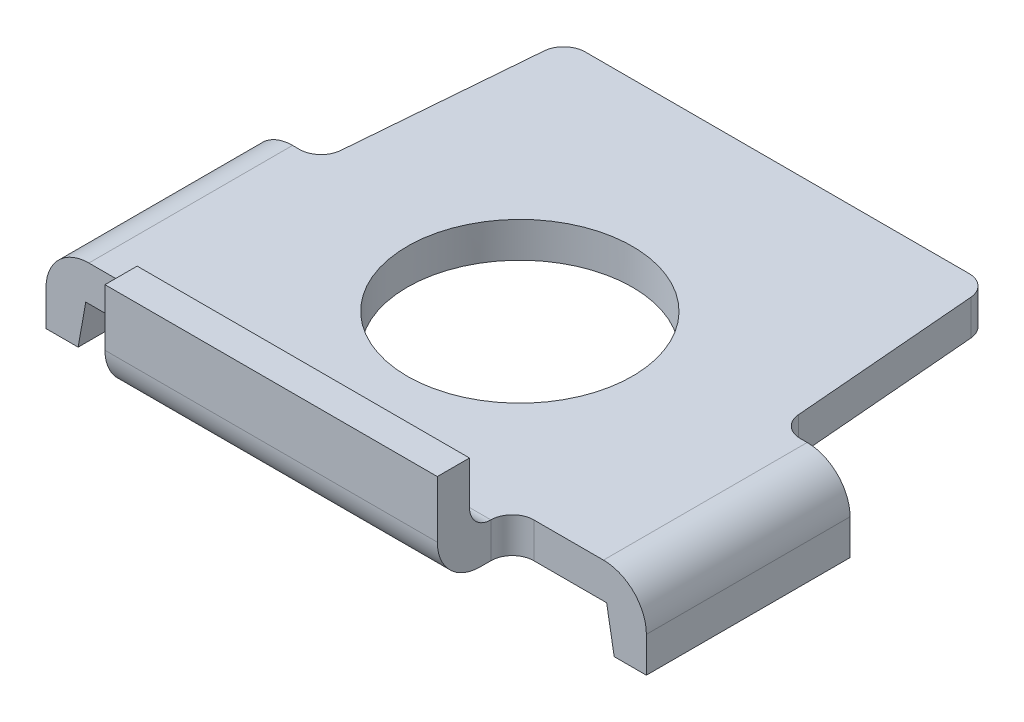
from build123d import *

# Parameters (mm, degrees)
RESSALTO_EXTRUS_O1_DEPTH = 1.65
ESBO_O2_W                = 15.5
ESBO_O2_H                = 1.5
RESSALTO_EXTRUS_O2_DEPTH = 3
ESBO_O3_W                = 1.5
ESBO_O3_H                = 9.5
RESSALTO_EXTRUS_O3_DEPTH = 2
ESBO_O4_R                = 5.25
CORTE_EXTRUS_O1_DEPTH    = 26.913997794
FILETE1_R                = 2
CHANFRO1_SIZE            = 0.352653961
CHANFRO1_SIZE_2          = 2
FILETE3_R                = 2
FILETE4_R                = 1
FILETE5_R                = 1
FILETE6_R                = 1
FILETE7_R                = 1


with BuildPart() as part:
    # Esboço1 → Ressalto-extrusão1 (new body)
    with BuildSketch(Plane(origin=(0, 0, 0), x_dir=(1, 0, 0), z_dir=(0, 1, 0))):
        Polygon((-9.875, 2.10086556), (9.875, 2.10086556), (10.75, -8.49913444), (14, -8.49913444), (14, -17.99913444), (7.75, -17.99913444), (7.75, -21.49913444), (-7.75, -21.49913444), (-7.75, -17.99913444), (-14, -17.99913444), (-14, -8.49913444), (-10.75, -8.49913444), align=None)
    extrude(amount=RESSALTO_EXTRUS_O1_DEPTH)

    # Esboço2 → Ressalto-extrusão2 (add)
    with BuildSketch(Plane(origin=(0, 1.65, 0), x_dir=(1, 0, 0), z_dir=(0, 1, 0))):
        with Locations((0, -20.74913444)):
            Rectangle(ESBO_O2_W, ESBO_O2_H)
    extrude(amount=RESSALTO_EXTRUS_O2_DEPTH)

    # Esboço3 → Ressalto-extrusão3 (add)
    with BuildSketch(Plane.XZ):
        with Locations((-13.25, 13.24913444)):
            Rectangle(ESBO_O3_W, ESBO_O3_H)
        with Locations((13.25, 13.24913444)):
            Rectangle(ESBO_O3_W, ESBO_O3_H)
    extrude(amount=RESSALTO_EXTRUS_O3_DEPTH)

    # Esboço4 → Corte-extrusão1 (cut, through all)
    with BuildSketch(Plane(origin=(0, 1.65, 0), x_dir=(1, 0, 0), z_dir=(0, 1, 0))):
        with Locations(Location((0, -9.89913444, 0), (0, 0, 270))):
            Circle(ESBO_O4_R)
    extrude(amount=-CORTE_EXTRUS_O1_DEPTH, mode=Mode.SUBTRACT)

    # Filete1
    filete1_edges = [part.edges().sort_by_distance(p)[0] for p in [
        (14, 1.65, 13.24913444),
        (-14, 1.65, 13.24913444),
    ]]
    fillet(filete1_edges, radius=FILETE1_R)

    # Chanfro1
    # the kernel refuses this chamfer: 2, 0.352653961 mm, written as the material it adds along each edge
    with BuildSketch(Plane(origin=(12.5, 0, 17.99913444), x_dir=(-0.9776715712462587, 0.21013876076743104, 0), z_dir=(0, 0, -1))) as chanfro1_piece_1_section:
        Polygon((CHANFRO1_SIZE * 0.977671572402, -CHANFRO1_SIZE * 0.210138761016), (-CHANFRO1_SIZE_2 * 0.210138760767, -CHANFRO1_SIZE_2 * 0.977671571246), (0, 0), align=None)
    chanfro1_piece_1 = extrude(amount=9.5, mode=Mode.PRIVATE)
    chanfro1_piece_1 = split(chanfro1_piece_1, bisect_by=Plane(origin=(12.403792596, -2, 13.24913444), z_dir=(0, 1, 0)), keep=Keep.TOP, mode=Mode.PRIVATE)
    add(chanfro1_piece_1)
    with BuildSketch(Plane(origin=(-12.5, 0, 17.99913444), x_dir=(0.9776715712462587, 0.21013876076743104, 0), z_dir=(0, 0, -1))) as chanfro1_piece_2_section:
        Polygon((CHANFRO1_SIZE * 0.977671572402, CHANFRO1_SIZE * 0.210138761016), (-CHANFRO1_SIZE_2 * 0.210138760767, CHANFRO1_SIZE_2 * 0.977671571246), (0, 0), align=None)
    chanfro1_piece_2 = extrude(amount=9.5, mode=Mode.PRIVATE)
    chanfro1_piece_2 = split(chanfro1_piece_2, bisect_by=Plane(origin=(-12.403792596, -2, 13.24913444), z_dir=(0, 1, 0)), keep=Keep.TOP, mode=Mode.PRIVATE)
    add(chanfro1_piece_2)

    # Filete3
    filete3_edges = [part.edges().sort_by_distance(p)[0] for p in [
        (0, 0, 21.49913444),
    ]]
    fillet(filete3_edges, radius=FILETE3_R)

    # Filete4
    filete4_edges = [part.edges().sort_by_distance(p)[0] for p in [
        (0, 1.65, 19.99913444),
    ]]
    fillet(filete4_edges, radius=FILETE4_R)

    # Filete5
    filete5_edges = [part.edges().sort_by_distance(p)[0] for p in [
        (-9.875, 0.825, -2.10086556),
    ]]
    fillet(filete5_edges, radius=FILETE5_R)

    # Filete6
    filete6_edges = [part.edges().sort_by_distance(p)[0] for p in [
        (9.875, 0.825, -2.10086556),
    ]]
    fillet(filete6_edges, radius=FILETE6_R)

    # Filete7
    filete7_edges = [part.edges().sort_by_distance(p)[0] for p in [
        (-10.75, 0.825, 8.49913444),
        (-7.75, 0.825, 17.99913444),
        (7.75, 0.825, 17.99913444),
        (10.75, 0.825, 8.49913444),
    ]]
    fillet(filete7_edges, radius=FILETE7_R)


solid = part.part
